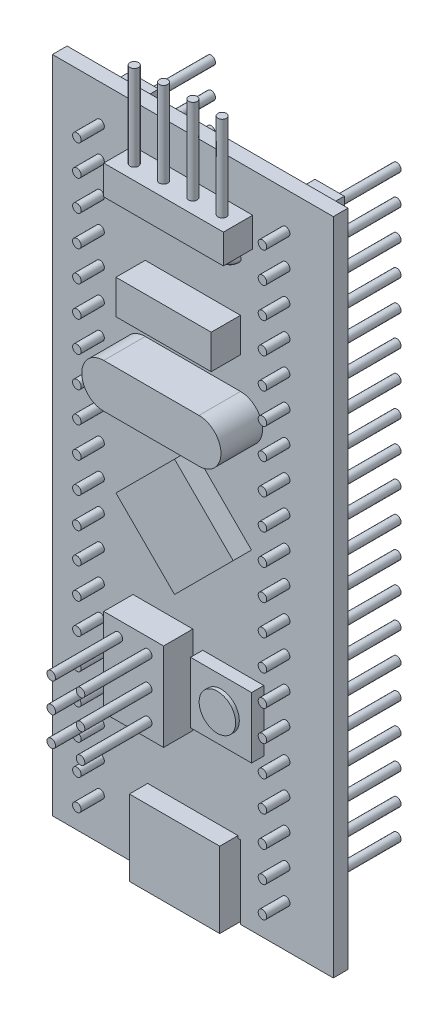
from build123d import *

# Parameters (mm, degrees)
SKETCH_1_W          = 23
SKETCH_1_H          = 54
EXTRUDE_1_DEPTH     = 1.2
SKETCH_2_W          = 2.4
SKETCH_2_H          = 50.6
EXTRUDE_2_DEPTH     = 2.4
SKETCH_3_R          = 0.35
EXTRUDE_3_DEPTH     = 5.5
SKETCH_4_W          = 9.8
SKETCH_4_H          = 2.4
SKETCH_4_W_2        = 4.9
SKETCH_4_H_2        = 7.2
SKETCH_4_W_3        = 7.8
SKETCH_4_H_3        = 2.8
EXTRUDE_4_DEPTH     = 2.4
SKETCH_5_R          = 0.35
EXTRUDE_5_DEPTH     = 7
SKETCH_6_R          = 0.35
SKETCH_7_R          = 0.35
EXTRUDE_6_DEPTH     = 5.5
SKETCH_8_W          = 7.4
SKETCH_8_H          = 6.2
EXTRUDE_7_DEPTH     = 1.5
EXTRUDE_8_DEPTH     = 3.4
SKETCH_10_W         = 5
SKETCH_10_H         = 5
EXTRUDE_9_DEPTH     = 1
SKETCH_11_R         = 1.495071924
EXTRUDE_10_DEPTH    = 0.3
CUT_EXTRUDE_1_DEPTH = 6


with BuildPart() as part:
    # Эскиз1 → Бобышка-Вытянуть1 (new body)
    with BuildSketch(Plane.XY):
        with Locations((0.400091461, -3.870786517)):
            Rectangle(SKETCH_1_W, SKETCH_1_H)
    extrude(amount=EXTRUDE_1_DEPTH)

    # Эскиз2 → Бобышка-Вытянуть2 (add)
    with BuildSketch(Plane(origin=(0, 0, 0), x_dir=(-1, 0, 0), z_dir=(0, 0, -1))):
        with Locations((-8.000091461, -3.870786517)):
            Rectangle(SKETCH_2_W, SKETCH_2_H)
        with Locations((7.199908539, -3.870786517)):
            Rectangle(SKETCH_2_W, SKETCH_2_H)
    extrude(amount=EXTRUDE_2_DEPTH)

    # Эскиз3 → Бобышка-Вытянуть3 (add, symmetric)
    with BuildSketch(Plane(origin=(0, 0, -2.4), x_dir=(-1, 0, 0), z_dir=(0, 0, -1))):
        with Locations((-8.000091461, 20.132856753)):
            Circle(SKETCH_3_R)
        with Locations((7.199908539, 20.132856753)):
            Circle(SKETCH_3_R)
        with Locations((7.199908539, 17.632856753)):
            Circle(SKETCH_3_R)
        with Locations((7.199908539, 15.132856753)):
            Circle(SKETCH_3_R)
        with Locations((7.199908539, 12.632856753)):
            Circle(SKETCH_3_R)
        with Locations((7.199908539, 10.132856753)):
            Circle(SKETCH_3_R)
        with Locations((7.199908539, 7.632856753)):
            Circle(SKETCH_3_R)
        with Locations((7.199908539, 5.132856753)):
            Circle(SKETCH_3_R)
        with Locations((7.199908539, 2.632856753)):
            Circle(SKETCH_3_R)
        with Locations((7.199908539, 0.132856753)):
            Circle(SKETCH_3_R)
        with Locations((7.199908539, -2.367143247)):
            Circle(SKETCH_3_R)
        with Locations((7.199908539, -4.867143247)):
            Circle(SKETCH_3_R)
        with Locations((7.199908539, -7.367143247)):
            Circle(SKETCH_3_R)
        with Locations((7.199908539, -9.867143247)):
            Circle(SKETCH_3_R)
        with Locations((7.199908539, -12.367143247)):
            Circle(SKETCH_3_R)
        with Locations((7.199908539, -14.867143247)):
            Circle(SKETCH_3_R)
        with Locations((7.199908539, -17.367143247)):
            Circle(SKETCH_3_R)
        with Locations((7.199908539, -19.867143247)):
            Circle(SKETCH_3_R)
        with Locations((7.199908539, -22.367143247)):
            Circle(SKETCH_3_R)
        with Locations((7.199908539, -24.867143247)):
            Circle(SKETCH_3_R)
        with Locations((7.199908539, -27.367143247)):
            Circle(SKETCH_3_R)
        with Locations((-8.000091461, 17.632856753)):
            Circle(SKETCH_3_R)
        with Locations((-8.000091461, 15.132856753)):
            Circle(SKETCH_3_R)
        with Locations((-8.000091461, 12.632856753)):
            Circle(SKETCH_3_R)
        with Locations((-8.000091461, 10.132856753)):
            Circle(SKETCH_3_R)
        with Locations((-8.000091461, 7.632856753)):
            Circle(SKETCH_3_R)
        with Locations((-8.000091461, 5.132856753)):
            Circle(SKETCH_3_R)
        with Locations((-8.000091461, 2.632856753)):
            Circle(SKETCH_3_R)
        with Locations((-8.000091461, 0.132856753)):
            Circle(SKETCH_3_R)
        with Locations((-8.000091461, -2.367143247)):
            Circle(SKETCH_3_R)
        with Locations((-8.000091461, -4.867143247)):
            Circle(SKETCH_3_R)
        with Locations((-8.000091461, -7.367143247)):
            Circle(SKETCH_3_R)
        with Locations((-8.000091461, -9.867143247)):
            Circle(SKETCH_3_R)
        with Locations((-8.000091461, -12.367143247)):
            Circle(SKETCH_3_R)
        with Locations((-8.000091461, -14.867143247)):
            Circle(SKETCH_3_R)
        with Locations((-8.000091461, -17.367143247)):
            Circle(SKETCH_3_R)
        with Locations((-8.000091461, -19.867143247)):
            Circle(SKETCH_3_R)
        with Locations((-8.000091461, -22.367143247)):
            Circle(SKETCH_3_R)
        with Locations((-8.000091461, -24.867143247)):
            Circle(SKETCH_3_R)
        with Locations((-8.000091461, -27.367143247)):
            Circle(SKETCH_3_R)
    extrude(amount=EXTRUDE_3_DEPTH, both=True)

    # Эскиз4 → Бобышка-Вытянуть4 (add)
    with BuildSketch(Plane.XY.offset(1.2)):
        with Locations((0.400091461, 18.729213483)):
            Rectangle(SKETCH_4_W, SKETCH_4_H)
        with Locations((-2.049908539, -15.470786517)):
            Rectangle(SKETCH_4_W_2, SKETCH_4_H_2)
        with Locations((0.400091461, 10.929213483)):
            Rectangle(SKETCH_4_W_3, SKETCH_4_H_3)
    extrude(amount=EXTRUDE_4_DEPTH)

    # Эскиз5 → Бобышка-Вытянуть5 (add)
    with BuildSketch(Plane(origin=(0, 19.929213483, 0), x_dir=(1, 0, 0), z_dir=(0, 1, 0))):
        with Locations((-3.199908539, -2.4)):
            Circle(SKETCH_5_R)
        with Locations((-0.799908539, -2.4)):
            Circle(SKETCH_5_R)
        with Locations((1.600091461, -2.4)):
            Circle(SKETCH_5_R)
        with Locations((4.000091461, -2.4)):
            Circle(SKETCH_5_R)
    extrude(amount=EXTRUDE_5_DEPTH)

    # Эскиз6 → Повернуть1 (revolve)
    with BuildSketch(Plane.XZ.offset(-17.529213483)):
        with Locations((-3.199908539, 2.4)):
            Circle(SKETCH_6_R)
        with Locations((-0.799908539, 2.4)):
            Circle(SKETCH_6_R)
        with Locations((1.600091461, 2.4)):
            Circle(SKETCH_6_R)
        with Locations((4.000091461, 2.4)):
            Circle(SKETCH_6_R)
    revolve(axis=Axis((-4.499908539, 17.529213483, 1.2), (1, 0, 0)))

    # Эскиз7 → Бобышка-Вытянуть6 (add, symmetric)
    with BuildSketch(Plane.XY.offset(3.6)):
        with Locations((-3.299908539, -13.070786517)):
            Circle(SKETCH_7_R)
        with Locations((-0.899908539, -13.070786517)):
            Circle(SKETCH_7_R)
        with Locations((-0.899908539, -15.470786517)):
            Circle(SKETCH_7_R)
        with Locations((-0.899908539, -17.870786517)):
            Circle(SKETCH_7_R)
        with Locations((-3.299908539, -15.470786517)):
            Circle(SKETCH_7_R)
        with Locations((-3.299908539, -17.870786517)):
            Circle(SKETCH_7_R)
    extrude(amount=EXTRUDE_6_DEPTH, both=True)

    # Эскиз8 → Бобышка-Вытянуть7 (add)
    with BuildSketch(Plane.XY.offset(1.2)):
        Polygon((-4.399908539, -3.870786517), (0.400091461, 0.929213483), (5.200091461, -3.870786517), (0.400091461, -8.670786517), align=None)
        with Locations((0.400091461, -27.770786517)):
            Rectangle(SKETCH_8_W, SKETCH_8_H)
    extrude(amount=EXTRUDE_7_DEPTH)

    # Эскиз9 → Бобышка-Вытянуть8 (add)
    with BuildSketch(Plane.XY.offset(1.2)):
        with BuildLine():
            Line((-3.499908539, 6.929213483), (4.300091461, 6.929213483))
            ThreePointArc((4.300091461, 6.929213483), (6.100091461, 5.129213483), (4.300091461, 3.329213483))
            Line((4.300091461, 3.329213483), (-3.499908539, 3.329213483))
            ThreePointArc((-3.499908539, 3.329213483), (-5.299908539, 5.129213483), (-3.499908539, 6.929213483))
        make_face()
    extrude(amount=EXTRUDE_8_DEPTH)

    # Эскиз10 → Бобышка-Вытянуть9 (add)
    with BuildSketch(Plane.XY.offset(1.2)):
        with Locations((3.709299321, -15.470786517)):
            Rectangle(SKETCH_10_W, SKETCH_10_H)
    extrude(amount=EXTRUDE_9_DEPTH)

    # Эскиз11 → Бобышка-Вытянуть10 (add)
    with BuildSketch(Plane.XY.offset(2.2)):
        with Locations((3.709299321, -15.470786517)):
            Circle(SKETCH_11_R)
    extrude(amount=EXTRUDE_10_DEPTH)

    # Эскиз12 → Вырез-Вытянуть1 (cut)
    with BuildSketch(Plane.XZ.offset(30.870786517)):
        Polygon((-3.48398033, 1.2), (-3.48398033, 0), (4.284163251, 0), (4.284163251, 1.2), (4.100091461, 1.2), (4.100091461, 0.727005887), (3.520830502, 0.185516694), (-2.720647581, 0.185516694), (-3.299908539, 0.727005887), (-3.299908539, 1.2), align=None)
    extrude(amount=-CUT_EXTRUDE_1_DEPTH, mode=Mode.SUBTRACT)


solid = part.part
